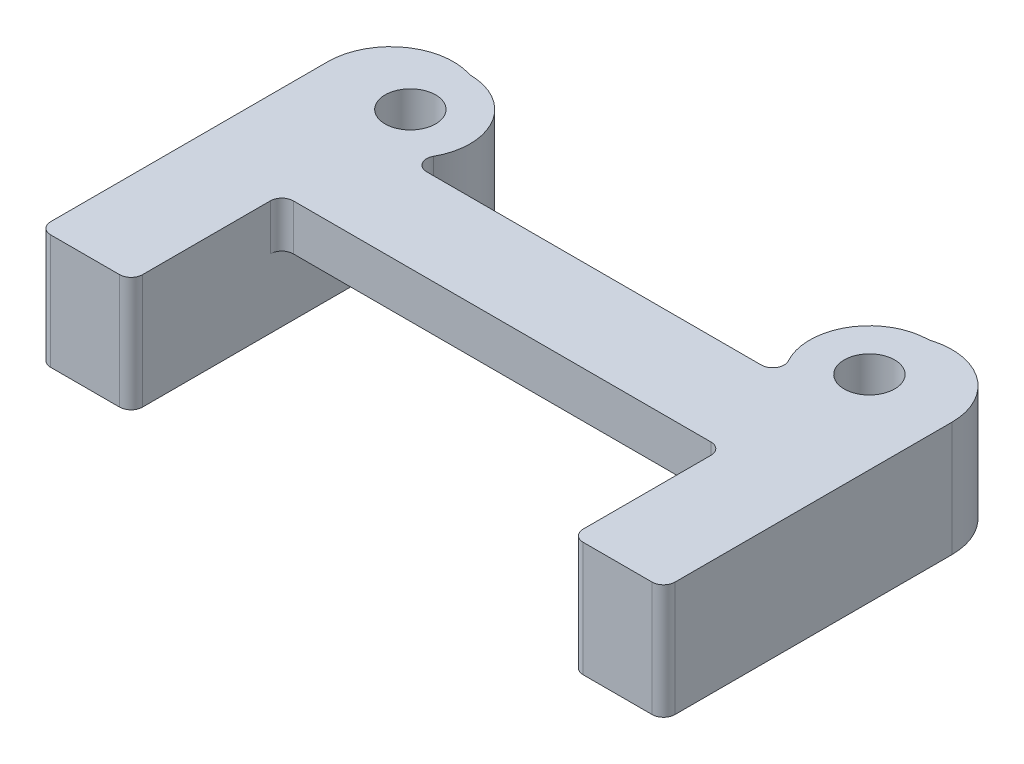
from build123d import *

# Parameters (mm, degrees)
SKETCH1_R           = 1.1
BASE_DEPTH          = 5
BOSS_EXTRUDE2_START = -2
BOSS_EXTRUDE2_DEPTH = 2
FILLET1_R           = 0.5


with BuildPart() as part:
    # Sketch1 → Base (new body)
    with BuildSketch(Plane(origin=(0, 0, 0), x_dir=(1, 0, 0), z_dir=(0, 1, 0))):
        with BuildLine():
            Line((3.6, 0), (3.6, -12.569046516))
            Line((3.6, -12.569046516), (-0.4, -12.569046516))
            Line((-0.4, -12.569046516), (-0.4, -2.569046516))
            ThreePointArc((-0.4, -2.569046516), (-2.592250079, 0.20059793), (0, 2.6))
            ThreePointArc((0, 2.6), (2.464704684, 2.220360331), (3.6, 0))
        make_face()
        Circle(SKETCH1_R, mode=Mode.SUBTRACT)
    extrude(amount=BASE_DEPTH)

    # Sketch2 → Boss-Extrude2 (add)
    with BuildSketch(Plane(origin=(0, 5, 0), x_dir=(1, 0, 0), z_dir=(0, 1, 0)).offset(BOSS_EXTRUDE2_START)):
        with BuildLine():
            ThreePointArc((-0.4, -2.569046516), (-1.069213935, -2.369975013), (-1.661324773, -2))
            Line((-1.661324773, -2), (-10, -2))
            Line((-10, -2), (-10, -6))
            Line((-10, -6), (-0.4, -6))
            Line((-0.4, -6), (-0.4, -2.569046516))
        make_face()
    extrude(amount=BOSS_EXTRUDE2_DEPTH)

    # Mirror2: part across plane


with BuildPart() as part_1:
    add(part.part)
    add(part.part.mirror(Plane.ZY.offset(10)))

    # Fillet1
    fillet1_edges = [part_1.edges().sort_by_distance(p)[0] for p in [
        (-20, 2.5, -2.6),
        (0, 2.5, -2.6),
        (-0.4, 1.5, 2.569046516),
        (-19.6, 1.5, 2.569046516),
        (-18.338675227, 4, 2),
        (-1.661324773, 4, 2),
        (3.6, 2.5, 12.569046516),
        (-0.4, 2.5, 12.569046516),
        (-0.4, 4, 6),
        (-19.6, 4, 6),
        (-23.6, 2.5, 12.569046516),
        (-19.6, 2.5, 12.569046516),
    ]]
    fillet(fillet1_edges, radius=FILLET1_R)


solid = part_1.part
